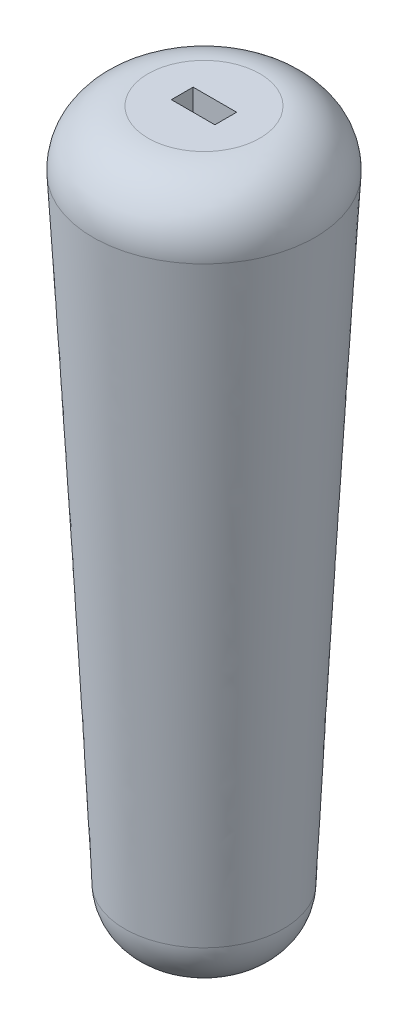
from build123d import *

# Parameters (mm, degrees)
FILLET3_R          = 25.4
SKETCH5_W          = 20
SKETCH5_H          = 10
CUT_EXTRUDE2_DEPTH = 12.7
SKETCH4_W          = 20
SKETCH4_H          = 10
CUT_EXTRUDE1_DEPTH = 12.7


with BuildPart() as part:
    # Loft1: read off the stored shape, not the designer's step
    # Loft1: loft between two sections, ruled curve by curve
    loft1_from = [
        Edge.make_bspline([(-51.426043, 0, -10.953459), (-29.519124, 0, -113.805546), (73.332962, 0, -91.898627), (51.426043, 0, 10.953459), (29.519124, 0, 113.805546), (-73.332962, 0, 91.898627), (-51.426043, 0, -10.953459)], [0, 0, 0, 0, 0.5, 0.5, 0.5, 1, 1, 1, 1], 3, [1, 0.333333, 0.333333, 1, 0.333333, 0.333333, 1]),
    ]
    loft1_to = [
        Edge.make_bspline([(-30.50695, -333.756, -17.938425), (5.369899, -333.756, -78.952326), (66.3838, -333.756, -43.075476), (30.50695, -333.756, 17.938425), (-5.369899, -333.756, 78.952326), (-66.3838, -333.756, 43.075476), (-30.50695, -333.756, -17.938425)], [0, 0, 0, 0, 0.5, 0.5, 0.5, 1, 1, 1, 1], 3, [1, 0.333333, 0.333333, 1, 0.333333, 0.333333, 1]),
    ]
    loft1 = Solid(Shell([*[Face.make_surface_from_curves(loft1_from[k], loft1_to[k]) for k in range(1)], Face(Wire(loft1_from)), Face(Wire(loft1_to))]))
    add(loft1)

    # Fillet3
    fillet3_edges = [part.edges().sort_by_distance(p)[0] for p in [
        (30.50695, -333.756, 17.938425),
        (51.426043, 0, 10.953459),
    ]]
    fillet(fillet3_edges, radius=FILLET3_R)

    # Sketch5 → Cut-Extrude2 (cut)
    with BuildSketch(Plane.XZ.offset(333.756)):
        Rectangle(SKETCH5_W, SKETCH5_H)
    extrude(amount=-CUT_EXTRUDE2_DEPTH, mode=Mode.SUBTRACT)

    # Sketch4 → Cut-Extrude1 (cut)
    with BuildSketch(Plane(origin=(0, 0, 0), x_dir=(1, 0, 0), z_dir=(0, 1, 0))):
        Rectangle(SKETCH4_W, SKETCH4_H)
    extrude(amount=-CUT_EXTRUDE1_DEPTH, mode=Mode.SUBTRACT)


solid = part.part
